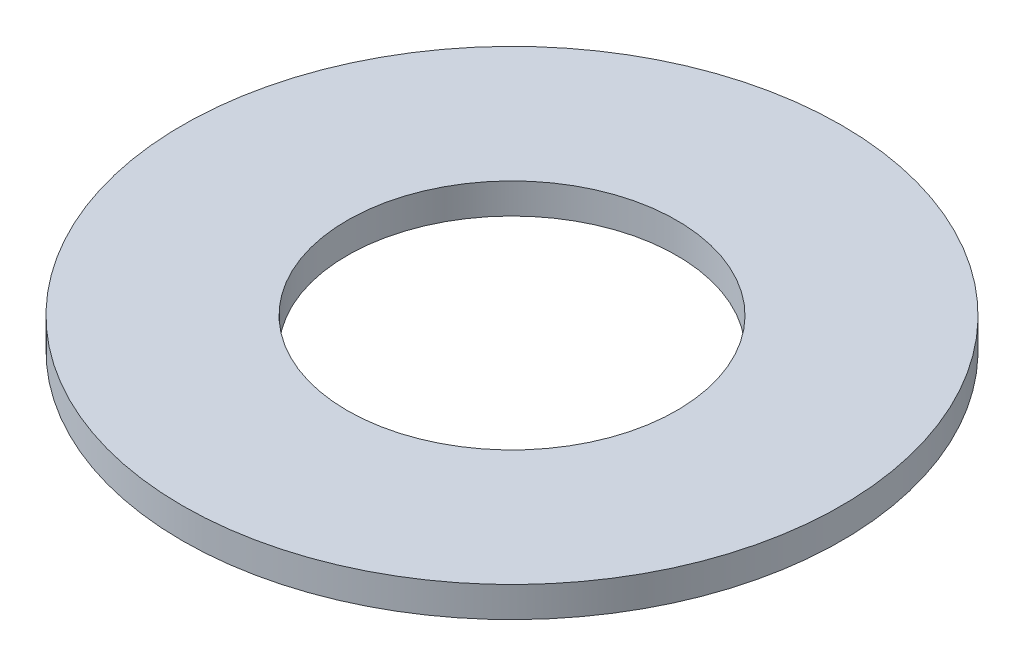
from build123d import *

# Parameters (mm, degrees)
SKETCH1_R           = 65
BOSS_EXTRUDE1_DEPTH = 6
SKETCH2_R           = 32.5
CUT_EXTRUDE1_DEPTH  = 93.119487623


with BuildPart() as part:
    # Sketch1 → Boss-Extrude1 (new body)
    with BuildSketch(Plane(origin=(0, 0, 0), x_dir=(1, 0, 0), z_dir=(0, 1, 0))):
        Circle(SKETCH1_R)
    extrude(amount=BOSS_EXTRUDE1_DEPTH)

    # Sketch2 → Cut-Extrude1 (cut, through all)
    with BuildSketch(Plane(origin=(0, 0, 0), x_dir=(1, 0, 0), z_dir=(0, 1, 0))):
        Circle(SKETCH2_R)
    extrude(amount=CUT_EXTRUDE1_DEPTH, mode=Mode.SUBTRACT)


solid = part.part
